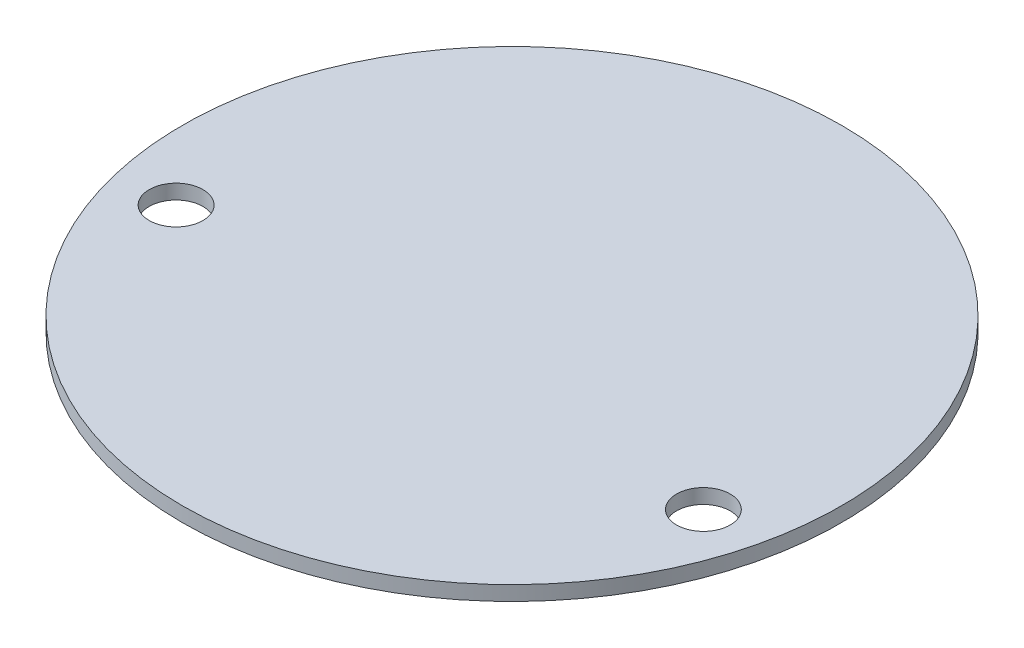
from build123d import *

# Parameters (mm, degrees)
SKETCH1_R           = 33.75
SKETCH1_R_2         = 2.75
BOSS_EXTRUDE1_DEPTH = 1.5


with BuildPart() as part:
    # Sketch1 → Boss-Extrude1 (new body)
    with BuildSketch(Plane(origin=(0, 0, 0), x_dir=(1, 0, 0), z_dir=(0, 1, 0))):
        Circle(SKETCH1_R)
        with Locations((-27, -7.4)):
            Circle(SKETCH1_R_2, mode=Mode.SUBTRACT)
        with Locations((27, -7.4)):
            Circle(SKETCH1_R_2, mode=Mode.SUBTRACT)
    extrude(amount=BOSS_EXTRUDE1_DEPTH)


solid = part.part
